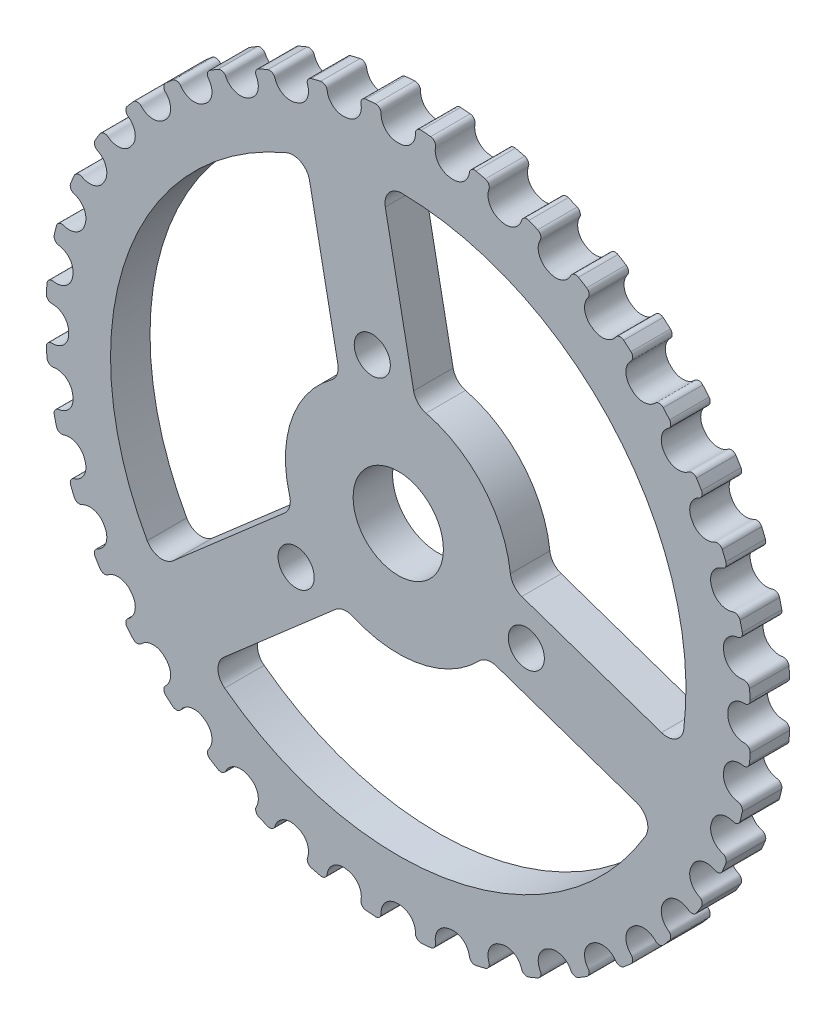
from build123d import *

# Parameters (mm, degrees)
SKETCHREVOLVEGEARBELT01_W       = 3.5
SKETCHREVOLVEGEARBELT01_H       = 31.259474731
TOOTHEXTRUDECUTGEARBELT01_DEPTH = 7.238999891
PATTERNGEARBELT01_COUNT         = 40
BOREREVOLVESKETCH_W             = 14.477999782
BOREREVOLVESKETCH_H             = 4
SKETCH1_R                       = 1.6
CUT_EXTRUDE1_DEPTH              = 10
CIRPATTERN1_COUNT               = 3


with BuildPart() as part:
    # SketchRevolveGearBelt01 → GearBelt01 (revolve)
    with BuildSketch(Plane(origin=(0, 0, 0), x_dir=(0, 0, -1), z_dir=(1, 0, 0))):
        with Locations((0, 15.629737366)):
            Rectangle(SKETCHREVOLVEGEARBELT01_W, SKETCHREVOLVEGEARBELT01_H)
    revolve(axis=Axis((0, 0, 0), (0, 0, -1)))

    # SketchToothGearBelt01 → ToothExtrudeCutGearBelt01 (cut, symmetric)
    with BuildSketch(Plane.XY):
        with BuildLine():
            ThreePointArc((31.193039128, 2.038865882), (31.259601152, 0), (31.193039128, -2.038865882))
            add(Edge.make_bspline(
                [(31.193039128, -2.038865882), (31.194776913, -2.012319058), (31.194111995, -1.972286092), (31.186725044, -1.91954954), (31.177972892, -1.880581805), (31.166066964, -1.842459179), (31.151086916, -1.805436436), (31.133132836, -1.769761004), (31.11232472, -1.735671302), (31.088801629, -1.703395156), (31.062720769, -1.673148271), (31.03425644, -1.645132783), (31.003598871, -1.619535939), (30.970952951, -1.596528744), (30.936536852, -1.576265181), (30.900580587, -1.558879838), (30.863324423, -1.544492019), (30.825017467, -1.533186249), (30.785915276, -1.525081482), (30.746280852, -1.520069931), (30.699160655, -1.5185581), (30.627744929, -1.519642809), (30.531954075, -1.516025397), (30.419766309, -1.502618406), (30.308964203, -1.4805345), (30.200238466, -1.449806972), (30.094256736, -1.410652655), (29.991672503, -1.363305381), (29.893117585, -1.308058815), (29.799199177, -1.245252775), (29.710495857, -1.175274324), (29.627554091, -1.09855453), (29.55088484, -1.015566038), (29.480960449, -0.926820101), (29.418211615, -0.832863447), (29.363025195, -0.73427489), (29.31574008, -0.631661826), (29.276651638, -0.525656278), (29.245985501, -0.416911781), (29.223987221, -0.306096466), (29.210580967, -0.193899714), (29.207480791, -0.105119728), (29.207768884, -0.040500395), (29.2077087, 0), (29.207768884, 0.040500395), (29.207480791, 0.105119728), (29.210580967, 0.193899714), (29.223987221, 0.306096466), (29.245985501, 0.416911781), (29.276651638, 0.525656278), (29.31574008, 0.631661826), (29.363025195, 0.73427489), (29.418211615, 0.832863447), (29.480960449, 0.926820101), (29.55088484, 1.015566038), (29.627554091, 1.09855453), (29.710495857, 1.175274324), (29.799199177, 1.245252775), (29.893117585, 1.308058815), (29.991672503, 1.363305381), (30.094256736, 1.410652655), (30.200238466, 1.449806972), (30.308964203, 1.4805345), (30.419766309, 1.502618406), (30.531954075, 1.516025397), (30.627744929, 1.519642809), (30.699160655, 1.5185581), (30.746280852, 1.520069931), (30.785915276, 1.525081482), (30.825017467, 1.533186249), (30.863324423, 1.544492019), (30.900580587, 1.558879838), (30.936536852, 1.576265181), (30.970952951, 1.596528744), (31.003598871, 1.619535939), (31.03425644, 1.645132783), (31.062720769, 1.673148271), (31.088801629, 1.703395156), (31.11232472, 1.735671302), (31.133132836, 1.769761004), (31.151086916, 1.805436436), (31.166066964, 1.842459179), (31.177972892, 1.880581805), (31.186725044, 1.91954954), (31.194111995, 1.972286092), (31.194776913, 2.012319058), (31.193039128, 2.038865882)],
                knots=[0, 0, 0, 0, 0.012475647, 0.018713471, 0.024951294, 0.031189118, 0.037426941, 0.043664765, 0.049902589, 0.056140412, 0.062378236, 0.068616059, 0.074853883, 0.081091706, 0.08732953, 0.093567353, 0.099805177, 0.106043001, 0.112280824, 0.118518648, 0.124756471, 0.134376181, 0.152024115, 0.169672048, 0.187319982, 0.204967916, 0.22261585, 0.240263783, 0.257911717, 0.275559651, 0.293207585, 0.310855518, 0.328503452, 0.346151386, 0.36379932, 0.381447253, 0.399095187, 0.416743121, 0.434391055, 0.452038988, 0.469686922, 0.487334856, 0.493667428, 0.5, 0.506332572, 0.512665144, 0.530313078, 0.547961012, 0.565608945, 0.583256879, 0.600904813, 0.618552747, 0.63620068, 0.653848614, 0.671496548, 0.689144482, 0.706792415, 0.724440349, 0.742088283, 0.759736217, 0.77738415, 0.795032084, 0.812680018, 0.830327952, 0.847975885, 0.865623819, 0.875243529, 0.881481352, 0.887719176, 0.893956999, 0.900194823, 0.906432647, 0.91267047, 0.918908294, 0.925146117, 0.931383941, 0.937621764, 0.943859588, 0.950097411, 0.956335235, 0.962573059, 0.968810882, 0.975048706, 0.981286529, 0.987524353, 1, 1, 1, 1], degree=3))
        make_face()
    toothextrudecutgearbelt01 = extrude(amount=TOOTHEXTRUDECUTGEARBELT01_DEPTH, both=True, mode=Mode.SUBTRACT)

    # PatternGearBelt01: ToothExtrudeCutGearBelt01 ×40 about axis
    patterngearbelt01_axis = Axis((0, 0, 55), (0, 0, -1))
    for i in range(1, PATTERNGEARBELT01_COUNT):
        add(toothextrudecutgearbelt01.rotate(patterngearbelt01_axis, i * 360 / PATTERNGEARBELT01_COUNT), mode=Mode.SUBTRACT)

    # BoreRevolveSketch → BoreRevolveCut (revolve, cut)
    with BuildSketch(Plane(origin=(0, 0, 0), x_dir=(0, 0, -1), z_dir=(1, 0, 0))):
        with Locations((0, 2)):
            Rectangle(BOREREVOLVESKETCH_W, BOREREVOLVESKETCH_H)
    revolve(axis=Axis((0, 0, 0), (0, 0, -1)), mode=Mode.SUBTRACT)

    # Sketch1 → Cut-Extrude1 (cut)
    with BuildSketch(Plane(origin=(0, 0, -1.75), x_dir=(-1, 0, 0), z_dir=(0, 0, -1))):
        with Locations((2.302032595, 11.77712384)):
            Circle(SKETCH1_R)
        with BuildLine():
            Line((-10.941670178, -0.138742248), (-23.328577588, -4.389403539))
            ThreePointArc((-23.328577588, -4.389403539), (-24.609768122, -4.243035015), (-25.303910833, -3.156278913))
            ThreePointArc((-25.303910833, -3.156278913), (-19.227578279, 16.749633833), (-0.342701545, 25.497697066))
            ThreePointArc((-0.342701545, 25.497697066), (0.828959731, 24.959103728), (1.149597849, 23.710078458))
            Line((1.149597849, 23.710078458), (-1.362675195, 10.857371322))
            ThreePointArc((-1.362675195, 10.857371322), (-1.744855813, 10.114597618), (-2.465057108, 9.691413388))
            ThreePointArc((-2.465057108, 9.691413388), (-7.540226776, 6.568483856), (-9.9378592, 1.113083342))
            ThreePointArc((-9.9378592, 1.113083342), (-10.258307485, 0.341664068), (-10.941670178, -0.138742248))
        make_face()
    cut_extrude1 = extrude(amount=-CUT_EXTRUDE1_DEPTH, mode=Mode.SUBTRACT)

    # CirPattern1: Cut-Extrude1 ×3 about axis
    cirpattern1_axis = Axis((0, 0, 0), (0, 0, 1))
    for i in range(1, CIRPATTERN1_COUNT):
        add(cut_extrude1.rotate(cirpattern1_axis, i * 360 / CIRPATTERN1_COUNT), mode=Mode.SUBTRACT)


solid = part.part
